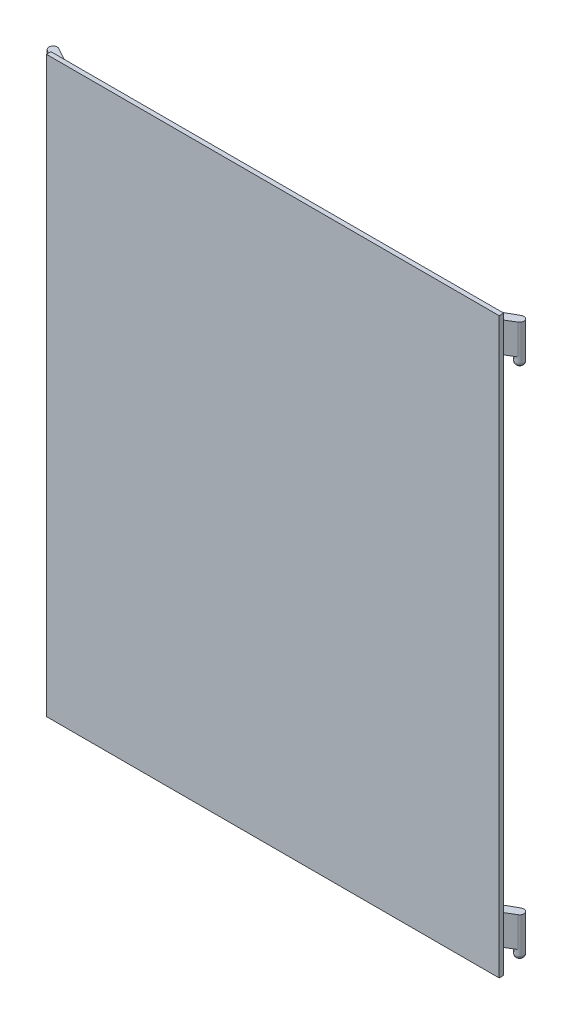
from build123d import *

# Parameters (mm, degrees)
SKETCH1_W            = 150
SKETCH1_H            = 1.5
BOSS_EXTRUDE1_DEPTH  = 190
BOSS_EXTRUDE2_DEPTH  = 10
BOSS_EXTRUDE3_START  = 3
SKETCH3_R            = 1.4
BOSS_EXTRUDE3_DEPTH  = 3
FILLET1_R            = 1
FILLET2_R            = 10
FILLET1_OF_MIRROR2_R = 1
FILLET2_OF_MIRROR2_R = 10
LPATTERN1_START      = 175.9999999
LPATTERN1_OUTLINE_R  = 1.4
LPATTERN1_DEPTH      = 12.0000001
LPATTERN1_START_2    = 178
LPATTERN1_2_DEPTH    = 10


with BuildPart() as part:
    # Sketch1 → Boss-Extrude1 (new body)
    with BuildSketch(Plane(origin=(0, 0, 0), x_dir=(1, 0, 0), z_dir=(0, 1, 0))):
        Rectangle(SKETCH1_W, SKETCH1_H)
    extrude(amount=BOSS_EXTRUDE1_DEPTH)

    # Sketch2 → Boss-Extrude2 (add)
    with BuildSketch(Plane(origin=(0, 8, 0), x_dir=(1, 0, 0), z_dir=(0, 1, 0))):
        with BuildLine():
            Line((-75, 0.75), (-77.993576193, 2.550233244))
            ThreePointArc((-77.993576193, 2.550233244), (-78.48384028, 4.451164765), (-76.591446047, 4.973413351))
            Line((-76.591446047, 4.973413351), (-69, 0.75))
            Line((-69, 0.75), (-75, 0.75))
        make_face()
    boss_extrude2 = extrude(amount=BOSS_EXTRUDE2_DEPTH)

    # Sketch3 → Boss-Extrude3 (add)
    with BuildSketch(Plane(origin=(0, 8, 0), x_dir=(-1, 0, 0), z_dir=(0, -1, 0)).offset(BOSS_EXTRUDE3_START)):
        with Locations(Location((77.272077939, 3.75, 0), (0, 0, 180))):
            Circle(SKETCH3_R)
    boss_extrude3 = extrude(amount=-BOSS_EXTRUDE3_DEPTH)

    # Fillet1
    fillet1_edges = [part.edges().sort_by_distance(p)[0] for p in [
        (-78.672077939, 5, -3.75),
    ]]
    fillet(fillet1_edges, radius=FILLET1_R)

    # Fillet2
    fillet2_edges = [part.edges().sort_by_distance(p)[0] for p in [
        (-69, 13, -0.75),
    ]]
    fillet(fillet2_edges, radius=FILLET2_R)

    # Mirror2: Boss-Extrude2, Boss-Extrude3 across plane
    add(boss_extrude2.mirror(Plane(origin=(0, 0, 0), x_dir=(0, 0, 1), z_dir=(1, 0, 0))))
    add(boss_extrude3.mirror(Plane(origin=(0, 0, 0), x_dir=(0, 0, 1), z_dir=(1, 0, 0))))

    # Fillet1 of Mirror2
    fillet1_of_mirror2_edges = [part.edges().sort_by_distance(p)[0] for p in [
        (78.672077939, 5, -3.75),
    ]]
    fillet(fillet1_of_mirror2_edges, radius=FILLET1_OF_MIRROR2_R)

    # Fillet2 of Mirror2
    fillet2_of_mirror2_edges = [part.edges().sort_by_distance(p)[0] for p in [
        (69, 13, -0.75),
    ]]
    fillet(fillet2_of_mirror2_edges, radius=FILLET2_OF_MIRROR2_R)



with BuildPart() as body_2:
    # LPattern1: read off the stored shape, not the designer's step
    # LPattern1 outline → LPattern1 (new body)
    with BuildSketch(Plane(origin=(0, 0, 0), x_dir=(1, 0, 0), z_dir=(0, 1, 0)).offset(LPATTERN1_START)):
        with Locations((-77.272077939, 3.75)):
            Circle(LPATTERN1_OUTLINE_R)
        with Locations((77.272077939, 3.75)):
            Circle(LPATTERN1_OUTLINE_R)
    extrude(amount=LPATTERN1_DEPTH)


with BuildPart() as part_1:
    add(part.part)

    add(body_2.part)  # LPattern1 2 merges body 2
    # LPattern1 2 outline → LPattern1 2 (add)
    with BuildSketch(Plane(origin=(0, 0, 0), x_dir=(1, 0, 0), z_dir=(0, 1, 0)).offset(LPATTERN1_START_2)):
        with BuildLine():
            ThreePointArc((71.267204788, 2.011333205), (68.916856052, 1.070468298), (66.40554842, 0.75))
            Line((66.40554842, 0.75), (75, 0.75))
            Line((75, 0.75), (77.993576193, 2.550233244))
            ThreePointArc((77.993576193, 2.550233244), (76.060315597, 3.048835235), (76.591446047, 4.973413351))
            Line((76.591446047, 4.973413351), (71.267204788, 2.011333205))
        make_face()
        with BuildLine():
            Line((-71.267204788, 2.011333205), (-76.591446047, 4.973413351))
            ThreePointArc((-76.591446047, 4.973413351), (-76.060315597, 3.048835235), (-77.993576193, 2.550233244))
            Line((-77.993576193, 2.550233244), (-75, 0.75))
            Line((-75, 0.75), (-66.40554842, 0.75))
            ThreePointArc((-66.40554842, 0.75), (-68.916856052, 1.070468298), (-71.267204788, 2.011333205))
        make_face()
    extrude(amount=LPATTERN1_2_DEPTH)

    # LPattern1 3 outline → LPattern1 3 (revolve)
    with BuildSketch(Plane(origin=(77.272077939, 0, -3.75), x_dir=(1, 0, 0), z_dir=(0, 0, 1))):
        with BuildLine():
            Line((0, 175.9999999), (0, 175))
            Line((0, 175), (0.4, 175))
            ThreePointArc((0.4, 175), (1.107106781, 175.292893219), (1.4, 176))
            Line((1.4, 176), (0, 175.9999999))
        make_face()
    revolve(axis=Axis((77.272077939, 0, -3.75), (0, 1, 0)))

    # LPattern1 4 outline → LPattern1 4 (revolve)
    with BuildSketch(Plane(origin=(-77.272077939, 0, -3.75), x_dir=(1, 0, 0), z_dir=(0, 0, 1))):
        with BuildLine():
            Line((0, 175.9999999), (0, 175))
            Line((0, 175), (0.4, 175))
            ThreePointArc((0.4, 175), (1.107106781, 175.292893219), (1.4, 176))
            Line((1.4, 176), (0, 175.9999999))
        make_face()
    revolve(axis=Axis((-77.272077939, 0, -3.75), (0, 1, 0)))


solid = part_1.part
